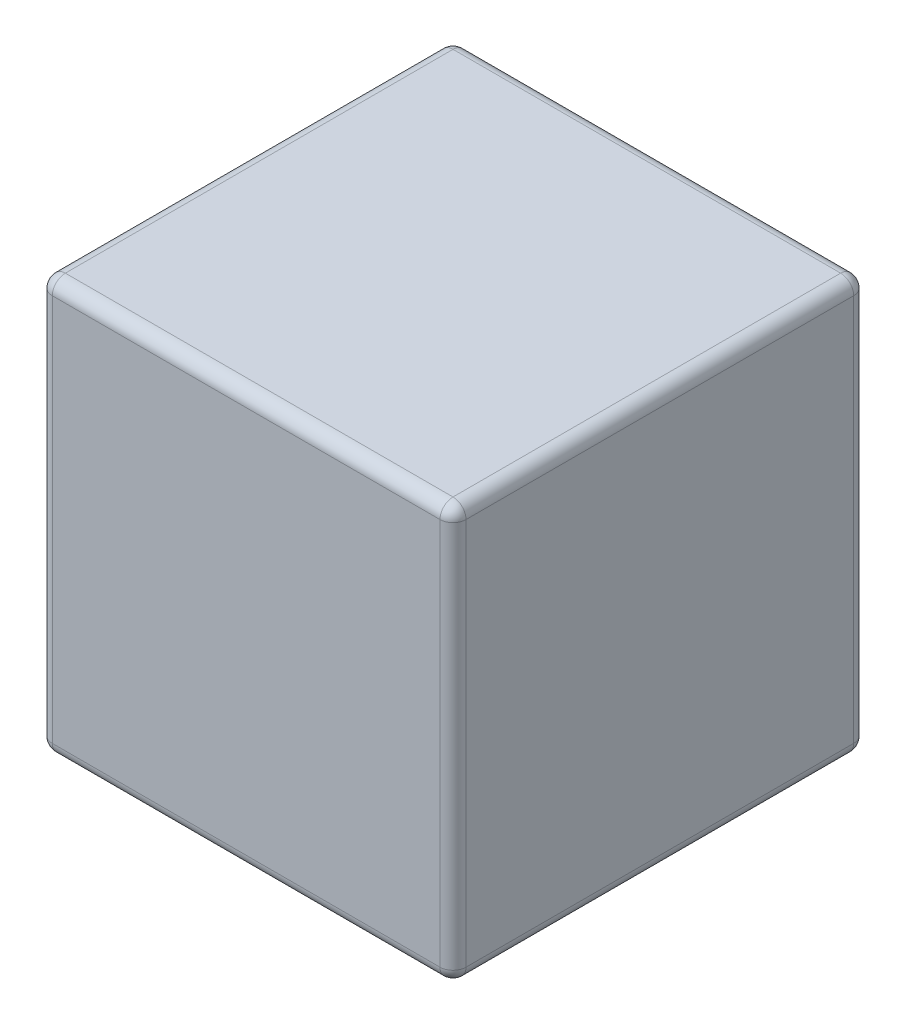
from build123d import *

# Parameters (mm, degrees)
SKETCH1_W           = 3.175
SKETCH1_H           = 3.175
BOSS_EXTRUDE1_DEPTH = 3.175
FILLET1_R           = 0.1


with BuildPart() as part:
    # Sketch1 → Boss-Extrude1 (new body)
    with BuildSketch(Plane(origin=(0, 0, 0), x_dir=(1, 0, 0), z_dir=(0, 1, 0))):
        Rectangle(SKETCH1_W, SKETCH1_H)
    extrude(amount=BOSS_EXTRUDE1_DEPTH)

    # Fillet1
    fillet1_edges = [part.edges().sort_by_distance(p)[0] for p in [
        (0, 3.175, 1.5875),
        (1.5875, 1.5875, -1.5875),
        (-1.5875, 1.5875, -1.5875),
        (-1.5875, 1.5875, 1.5875),
        (1.5875, 1.5875, 1.5875),
        (-1.5875, 3.175, 0),
        (0, 3.175, -1.5875),
        (1.5875, 3.175, 0),
        (0, 0, 1.5875),
        (-1.5875, 0, 0),
        (0, 0, -1.5875),
        (1.5875, 0, 0),
    ]]
    fillet(fillet1_edges, radius=FILLET1_R)


solid = part.part
